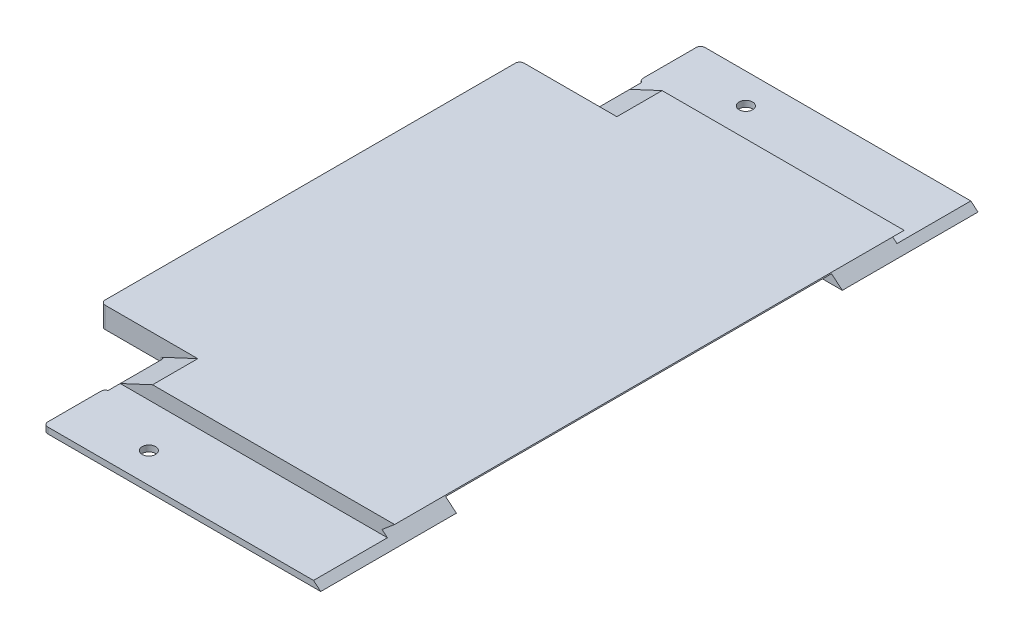
from build123d import *

# Parameters (mm, degrees)
SKIZZE2_W                       = 112.5
SKIZZE2_H                       = 109
AUFSATZ_LINEAR_AUSTRAGEN1_DEPTH = 2
SKIZZE3_W                       = 20.5
SKIZZE3_H                       = 20.5
SCHNITT_LINEAR_AUSTRAGEN1_DEPTH = 157.656471299
SKIZZE5_W                       = 91
SKIZZE5_H                       = 84.5
AUFSATZ_LINEAR_AUSTRAGEN2_DEPTH = 5
SKIZZE8_W                       = 21.5
SKIZZE8_H                       = 19
SCHNITT_LINEAR_AUSTRAGEN3_DEPTH = 157.723482606
SKIZZE9_W                       = 21.5
SKIZZE9_H                       = 69.5
AUFSATZ_LINEAR_AUSTRAGEN3_DEPTH = 5
FASE1_SIZE                      = 5
FASE1_SIZE2                     = 10.722534603
SKIZZE10_W                      = 85.75
SKIZZE10_H                      = 128
SCHNITT_LINEAR_AUSTRAGEN4_DEPTH = 3
VERRUNDUNG1_R                   = 1
DURCHGANGSLOCH_F_R_M41_D        = 4.5
DURCHGANGSLOCH_F_R_M41_DEPTH    = 6
VERRUNDUNG2_R                   = 1.5
SCHNITT_LINEAR_AUSTRAGEN7_DEPTH = 246.416482739


with BuildPart() as part:
    # Skizze2 → Aufsatz-Linear austragen1 (new body)
    with BuildSketch(Plane(origin=(0, 0, 0), x_dir=(1, 0, 0), z_dir=(0, 1, 0))):
        with Locations((-56.25, 54.5)):
            Rectangle(SKIZZE2_W, SKIZZE2_H)
    extrude(amount=AUFSATZ_LINEAR_AUSTRAGEN1_DEPTH)

    # Skizze3 → Schnitt-Linear austragen1 (cut, through all)
    with BuildSketch(Plane(origin=(0, 2, 0), x_dir=(1, 0, 0), z_dir=(0, 1, 0))):
        with Locations((-102.25, 98.75)):
            Rectangle(SKIZZE3_W, SKIZZE3_H)
    extrude(amount=-SCHNITT_LINEAR_AUSTRAGEN1_DEPTH, mode=Mode.SUBTRACT)

    # Skizze5 → Aufsatz-Linear austragen2 (add)
    with BuildSketch(Plane(origin=(0, 2, 0), x_dir=(1, 0, 0), z_dir=(0, 1, 0))):
        with Locations((-45.5, 42.25)):
            Rectangle(SKIZZE5_W, SKIZZE5_H)
    extrude(amount=AUFSATZ_LINEAR_AUSTRAGEN2_DEPTH)

    # Skizze8 → Schnitt-Linear austragen3 (cut, through all)
    with BuildSketch(Plane(origin=(0, 2, 0), x_dir=(1, 0, 0), z_dir=(0, 1, 0))):
        with Locations((-101.75, 79)):
            Rectangle(SKIZZE8_W, SKIZZE8_H)
    extrude(amount=-SCHNITT_LINEAR_AUSTRAGEN3_DEPTH, mode=Mode.SUBTRACT)

    # Skizze9 → Aufsatz-Linear austragen3 (add)
    with BuildSketch(Plane(origin=(0, 2, 0), x_dir=(1, 0, 0), z_dir=(0, 1, 0))):
        with Locations((-101.75, 34.75)):
            Rectangle(SKIZZE9_W, SKIZZE9_H)
    extrude(amount=AUFSATZ_LINEAR_AUSTRAGEN3_DEPTH)

    # Fase1
    fase1_edges = [part.edges().sort_by_distance(p)[0] for p in [
        (-91, 7, -77),
    ]]
    fase1_side = [part.faces().sort_by_distance(p)[0] for p in [
        (-91, 3.32300885, -77.672566372),
    ]]
    chamfer(fase1_edges, length=FASE1_SIZE, length2=FASE1_SIZE2, reference=fase1_side[0])

    # Skizze10 → Schnitt-Linear austragen4 (cut)
    with BuildSketch(Plane(origin=(0, 0, 0), x_dir=(1, 0, 0), z_dir=(0, 1, 0))):
        Rectangle(SKIZZE10_W, SKIZZE10_H)
    extrude(amount=SCHNITT_LINEAR_AUSTRAGEN4_DEPTH, mode=Mode.SUBTRACT)

    # Verrundung1
    verrundung1_edges = [part.edges().sort_by_distance(p)[0] for p in [
        (-42.875, 1.5, -64),
    ]]
    fillet(verrundung1_edges, radius=VERRUNDUNG1_R)

    # Durchgangsloch für M41
    with Locations(Plane(origin=(0, 0, 0), x_dir=(-1, 0, 0), z_dir=(0, -1, 0))):
        with Locations((67, 99)):
            Hole(DURCHGANGSLOCH_F_R_M41_D / 2, depth=DURCHGANGSLOCH_F_R_M41_DEPTH)

    # Verrundung2
    # the kernel refuses this fillet: 1.5 mm, written as the material it adds along each edge
    with BuildSketch(Plane(origin=(-91, 0, -69.5), x_dir=(-1, 0, 0), z_dir=(0, 1, 0))) as verrundung2_piece_1_section:
        with BuildLine():
            CenterArc((VERRUNDUNG2_R, -VERRUNDUNG2_R), VERRUNDUNG2_R, 90, 90)
            Line((0, -VERRUNDUNG2_R), (0, 0))
            Line((0, 0), (VERRUNDUNG2_R, 0))
        make_face()
    verrundung2_piece_1 = extrude(amount=5.75, mode=Mode.PRIVATE)
    verrundung2_piece_1 = split(verrundung2_piece_1, bisect_by=Plane(origin=(-91.766044443, 1.64278761, -69.5), z_dir=(0.4226182617406971, -0.906307787036651, 0)), keep=Keep.TOP, mode=Mode.PRIVATE)
    add(verrundung2_piece_1)
    # the kernel refuses this fillet: 1.5 mm, written as the material it takes off along each edge
    with BuildSketch(Plane(origin=(-92, 5.535533906, -88.5), x_dir=(0, 0, -1), z_dir=(0, -1, 0))) as verrundung2_2_piece_1:
        with BuildLine():
            CenterArc((1.414213562, 1.5), VERRUNDUNG2_R, 199.471220634, 70.528779366)
            Line((0, 1), (0, 0))
            Line((0, 0), (1.414213562, 0))
        make_face()
    extrude(amount=9.071067812, mode=Mode.SUBTRACT)
    with BuildSketch(Plane(origin=(-112.5, 10.75, -69.5), x_dir=(1, 0, 0), z_dir=(0, -1, 0))) as verrundung2_2_piece_2:
        with BuildLine():
            CenterArc((VERRUNDUNG2_R, VERRUNDUNG2_R), VERRUNDUNG2_R, 180, 90)
            Line((0, VERRUNDUNG2_R), (0, 0))
            Line((0, 0), (VERRUNDUNG2_R, 0))
        make_face()
    extrude(amount=14.5, mode=Mode.SUBTRACT)
    with BuildSketch(Plane(origin=(-92, 5.75, -109), x_dir=(1, 0, 0), z_dir=(0, -1, 0))) as verrundung2_2_piece_3:
        with BuildLine():
            CenterArc((VERRUNDUNG2_R, VERRUNDUNG2_R), VERRUNDUNG2_R, 180, 90)
            Line((0, VERRUNDUNG2_R), (0, 0))
            Line((0, 0), (VERRUNDUNG2_R, 0))
        make_face()
    extrude(amount=9.5, mode=Mode.SUBTRACT)

    # Spiegeln1: part across face


with BuildPart() as part_1:
    add(part.part)
    add(part.part.mirror(Plane(origin=(-63.046065737, 3.890438247, 0), x_dir=(1, 0, 0), z_dir=(0, 0, 1))))

    # Spiegeln2: part across plane


with BuildPart() as part_2:
    add(part_1.part)
    add(part_1.part.mirror(Plane(origin=(0, 2, 0), x_dir=(0, 0, 1), z_dir=(-1, 0, 0))))

    # Skizze15 → Schnitt-Linear austragen7 (cut, through all)
    with BuildSketch(Plane(origin=(0, 0, -109), x_dir=(-1, 0, 0), z_dir=(0, 0, -1))):
        Polygon((0, 0), (4.171137574, 3.5), (0, 7), (-112.5, 7), (-112.5, 0), align=None)
    extrude(amount=-SCHNITT_LINEAR_AUSTRAGEN7_DEPTH, mode=Mode.SUBTRACT)


solid = part_2.part
